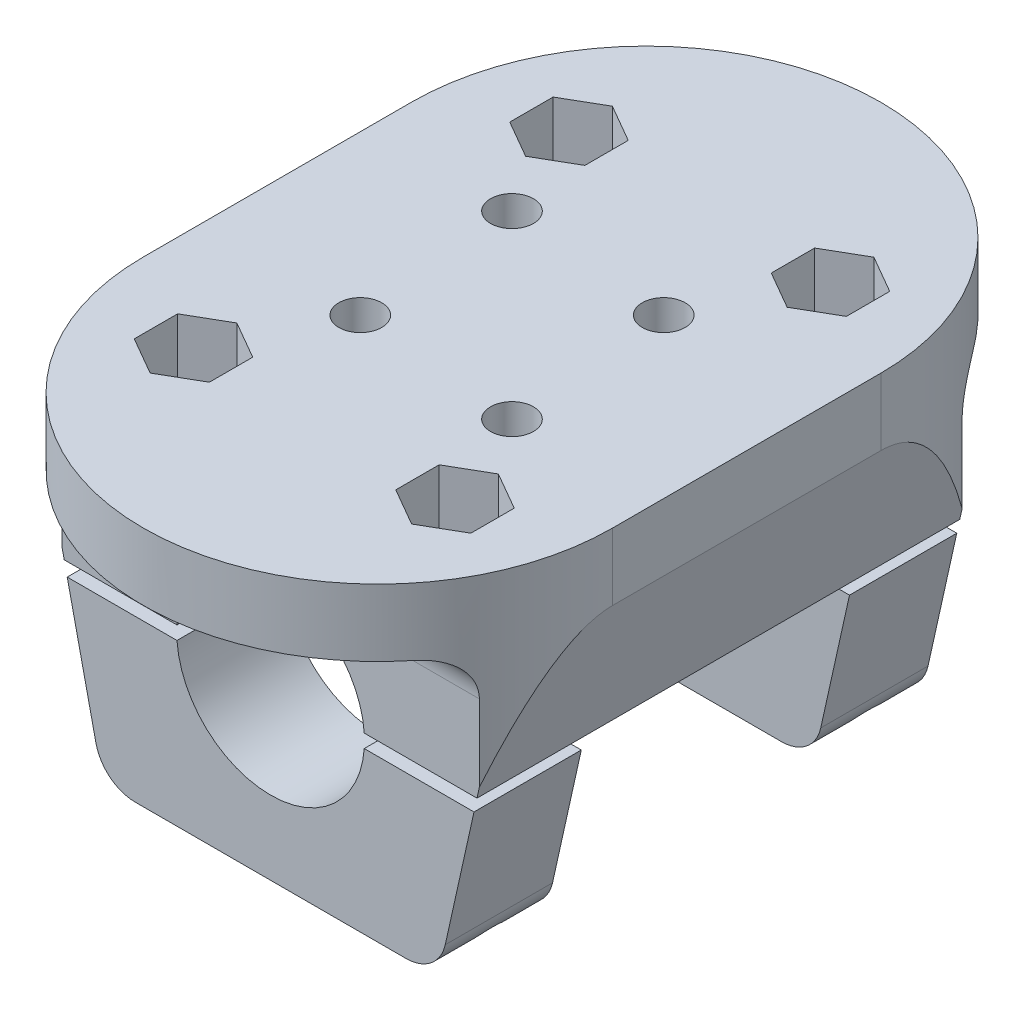
from build123d import *

# Parameters (mm, degrees)
IZIM1_R                        = 1.6
Y_KSEKLIK_EKSTR_ZYON1_DEPTH    = 5
Y_KSEKLIK_EKSTR_ZYON2_START    = -10
IZIM2_R                        = 7
Y_KSEKLIK_EKSTR_ZYON2_DEPTH    = 8
KES_EKSTR_ZYON2_DEPTH          = 43.646805273
KES_EKSTR_ZYON_NCE1_DEPTH      = 40.607448794
KES_EKSTR_ZYON_NCE1_DEPTH_BACK = 40.607448794
IZIM4_W                        = 35
IZIM4_H                        = 1
IZIM5_R                        = 1.6
KES_EKSTR_ZYON3_DEPTH          = 43.646805273
IZIM6_R                        = 2.75
KES_EKSTR_ZYON4_DEPTH          = 3.2
KES_EKSTR_ZYON5_DEPTH          = 4.5
RADYUS1_START                  = -19
RADYUS1_DEPTH                  = 10
Y_KSEKLIK_EKSTR_ZYON3_REACH    = 49.104
KES_EKSTR_ZYON6_START          = -9.5
IZIM9_R                        = 3
KES_EKSTR_ZYON6_DEPTH          = 9.5
RADYUS2_START                  = 9
RADYUS2_DEPTH                  = 10
RADYUS3_R                      = 3


with BuildPart() as part:
    # Çizim1 → Yükseklik-Ekstrüzyon1 (new body)
    with BuildSketch(Plane(origin=(0, 0, 0), x_dir=(1, 0, 0), z_dir=(0, 1, 0))):
        with BuildLine():
            Line((-17.5, -10), (-17.5, 10))
            ThreePointArc((-17.5, 10), (0, 27.5), (17.5, 10))
            Line((17.5, 10), (17.5, -10))
            ThreePointArc((17.5, -10), (0, -27.5), (-17.5, -10))
        make_face()
        with Locations(Location((5.656854249, 5.656854249, 0), (0, 0, 270))):
            Circle(IZIM1_R, mode=Mode.SUBTRACT)
        with Locations(Location((-6.717514421, 6.717514421, 0), (0, 0, 270))):
            Circle(IZIM1_R, mode=Mode.SUBTRACT)
        with Locations(Location((-5.656854249, -5.656854249, 0), (0, 0, 270))):
            Circle(IZIM1_R, mode=Mode.SUBTRACT)
        with Locations(Location((6.717514421, -6.717514421, 0), (0, 0, 270))):
            Circle(IZIM1_R, mode=Mode.SUBTRACT)
    extrude(amount=Y_KSEKLIK_EKSTR_ZYON1_DEPTH)

    # Çizim2 → Yükseklik-Ekstrüzyon2 (add)
    with BuildSketch(Plane.XY.offset(Y_KSEKLIK_EKSTR_ZYON2_START)):
        Polygon((-17.5, 0), (17.5, 0), (12.5, -22.5), (-12.5, -22.5), align=None)
        with Locations((0, -10)):
            Circle(IZIM2_R, mode=Mode.SUBTRACT)
    y_kseklik_ekstr_zyon2 = extrude(amount=-Y_KSEKLIK_EKSTR_ZYON2_DEPTH)

    # Çizim3 → Kes-Ekstrüzyon2 (cut, through all)
    with BuildSketch(Plane(origin=(0, 5, 0), x_dir=(1, 0, 0), z_dir=(0, 1, 0))):
        with BuildLine():
            Line((22.5, 10), (17.5, 10))
            ThreePointArc((17.5, 10), (0, 27.5), (-17.5, 10))
            Line((-17.5, 10), (-22.5, 10))
            Line((-22.5, 10), (-22.5, 30))
            Line((-22.5, 30), (22.5, 30))
            Line((22.5, 30), (22.5, 10))
        make_face()
    kes_ekstr_zyon2 = extrude(amount=-KES_EKSTR_ZYON2_DEPTH, mode=Mode.SUBTRACT)

    # Aynalama1: Yükseklik-Ekstrüzyon2, Kes-Ekstrüzyon2 across plane
    add(y_kseklik_ekstr_zyon2.mirror(Plane.XY))
    add(kes_ekstr_zyon2.mirror(Plane.XY), mode=Mode.SUBTRACT)

    # Çizim4 → Kes-Ekstrüzyon-İnce1 (cut, two sides: drawn at the far end of the back side and taken through both)
    with BuildSketch(Plane.XY.offset(-KES_EKSTR_ZYON_NCE1_DEPTH_BACK)):
        with Locations((0, -10)):
            Rectangle(IZIM4_W, IZIM4_H)
    extrude(amount=KES_EKSTR_ZYON_NCE1_DEPTH + KES_EKSTR_ZYON_NCE1_DEPTH_BACK, mode=Mode.SUBTRACT)


with BuildPart() as kes_ekstr_zyon_nce1_piece_1:
    # of the separate pieces the step leaves, piece 1, a body of its own (kes_ekstr_zyon_nce1_pieces)
    add(part.part.solids().sort_by_distance((-17.5, 0, 10))[0])


with BuildPart() as kes_ekstr_zyon_nce1_piece_2:
    # of the separate pieces the step leaves, piece 2, a body of its own (kes_ekstr_zyon_nce1_pieces)
    add(part.part.solids().sort_by_distance((-12.5, -22.5, 10))[0])


with BuildPart() as kes_ekstr_zyon_nce1_piece_3:
    # of the separate pieces the step leaves, piece 3, a body of its own (kes_ekstr_zyon_nce1_pieces)
    add(part.part.solids().sort_by_distance((-12.5, -22.5, -10))[0])


with BuildPart() as kes_ekstr_zyon3_tool:
    # Çizim5 → Kes-Ekstrüzyon3 (new, through all)
    with BuildSketch(Plane.XZ.offset(22.5)):
        with Locations((9.75, 14)):
            Circle(IZIM5_R)
        with Locations((-9.75, 14)):
            Circle(IZIM5_R)
        with Locations((-9.75, -14)):
            Circle(IZIM5_R)
        with Locations((9.75, -14)):
            Circle(IZIM5_R)
    extrude(amount=-KES_EKSTR_ZYON3_DEPTH)


with BuildPart() as kes_ekstr_zyon_nce1_piece_1_1:
    add(kes_ekstr_zyon_nce1_piece_1.part)

    # Kes-Ekstrüzyon3: cut by kes_ekstr_zyon3_tool
    add(kes_ekstr_zyon3_tool.part, mode=Mode.SUBTRACT)

    # Çizim7 → Kes-Ekstrüzyon5 (cut)
    with BuildSketch(Plane(origin=(0, 5, 0), x_dir=(1, 0, 0), z_dir=(0, 1, 0))):
        Polygon((-6.95, 12.383419246), (-6.95, 15.616580754), (-9.75, 17.233161507), (-12.55, 15.616580754), (-12.55, 12.383419246), (-9.75, 10.766838493), align=None)
        Polygon((6.95, 12.383419246), (6.95, 15.616580754), (9.75, 17.233161507), (12.55, 15.616580754), (12.55, 12.383419246), (9.75, 10.766838493), align=None)
        Polygon((9.75, -10.766838493), (6.95, -12.383419246), (6.95, -15.616580754), (9.75, -17.233161507), (12.55, -15.616580754), (12.55, -12.383419246), align=None)
        Polygon((-6.95, -12.383419246), (-6.95, -15.616580754), (-9.75, -17.233161507), (-12.55, -15.616580754), (-12.55, -12.383419246), (-9.75, -10.766838493), align=None)
    extrude(amount=-KES_EKSTR_ZYON5_DEPTH, mode=Mode.SUBTRACT)

    # Çizim8 → Yükseklik-Ekstrüzyon3 (add, up to next)
    with BuildSketch(Plane.XY.offset(-10), mode=Mode.PRIVATE) as y_kseklik_ekstr_zyon3_sk1:
        with BuildLine():
            Line((-17.5, 0), (-15.388888889, -9.5))
            Line((-15.388888889, -9.5), (-6.982120022, -9.5))
            ThreePointArc((-6.982120022, -9.5), (0, -3), (6.982120022, -9.5))
            Line((6.982120022, -9.5), (15.388888889, -9.5))
            Line((15.388888889, -9.5), (17.5, 0))
            Line((17.5, 0), (-17.5, 0))
        make_face()
    y_kseklik_ekstr_zyon3_tool1 = extrude(y_kseklik_ekstr_zyon3_sk1.sketch, amount=Y_KSEKLIK_EKSTR_ZYON3_REACH, mode=Mode.PRIVATE) - kes_ekstr_zyon_nce1_piece_1_1.part
    add(y_kseklik_ekstr_zyon3_tool1.solids().sort_by_distance((-16.090417, -4.671327, -10))[0])

    # Çizim9 → Kes-Ekstrüzyon6 (cut)
    with BuildSketch(Plane(origin=(0, 0, 0), x_dir=(1, 0, 0), z_dir=(0, 1, 0)).offset(KES_EKSTR_ZYON6_START)):
        with Locations(Location((6.717514421, -6.717514421, 0), (0, 0, 270))):
            Circle(IZIM9_R)
        with Locations(Location((5.656854249, 5.656854249, 0), (0, 0, 270))):
            Circle(IZIM9_R)
        with Locations(Location((-6.717514421, 6.717514421, 0), (0, 0, 270))):
            Circle(IZIM9_R)
        with Locations(Location((-5.656854249, -5.656854249, 0), (0, 0, 270))):
            Circle(IZIM9_R)
    extrude(amount=KES_EKSTR_ZYON6_DEPTH, mode=Mode.SUBTRACT)

    # Radyus3
    # the kernel refuses this fillet: 3 mm, written as the material it adds along each edge
    with BuildSketch(Plane(origin=(-23.064382416, 0, 18), x_dir=(0, -1, 0), z_dir=(1, 0, 0))) as radyus3_piece_1_section:
        with BuildLine():
            CenterArc((RADYUS3_R, -RADYUS3_R), RADYUS3_R, 90, 90)
            Line((0, -RADYUS3_R), (0, 0))
            Line((0, 0), (RADYUS3_R, 0))
        make_face()
    radyus3_piece_1 = extrude(amount=46.128764833, mode=Mode.PRIVATE)
    radyus3_piece_1 = radyus3_piece_1 & Plane(origin=(0, 0, 10), x_dir=(1, 0, 0), z_dir=(0, -1, 0)) * Cylinder(17.5, 105, mode=Mode.PRIVATE)
    add(radyus3_piece_1)
    with BuildSketch(Plane(origin=(-23.064382416, 0, -18), x_dir=(0, 0, -1), z_dir=(1, 0, 0))) as radyus3_piece_2_section:
        with BuildLine():
            CenterArc((RADYUS3_R, -RADYUS3_R), RADYUS3_R, 90, 90)
            Line((0, -RADYUS3_R), (0, 0))
            Line((0, 0), (RADYUS3_R, 0))
        make_face()
    radyus3_piece_2 = extrude(amount=46.128764833, mode=Mode.PRIVATE)
    radyus3_piece_2 = radyus3_piece_2 & Plane(origin=(0, 0, -10), x_dir=(-1, 0, 0), z_dir=(0, -1, 0)) * Cylinder(17.5, 105, mode=Mode.PRIVATE)
    add(radyus3_piece_2)


with BuildPart() as kes_ekstr_zyon_nce1_piece_2_1:
    add(kes_ekstr_zyon_nce1_piece_2.part)

    # Kes-Ekstrüzyon3: cut by kes_ekstr_zyon3_tool
    add(kes_ekstr_zyon3_tool.part, mode=Mode.SUBTRACT)


with BuildPart() as kes_ekstr_zyon_nce1_piece_3_1:
    add(kes_ekstr_zyon_nce1_piece_3.part)

    # Kes-Ekstrüzyon3: cut by kes_ekstr_zyon3_tool
    add(kes_ekstr_zyon3_tool.part, mode=Mode.SUBTRACT)


with BuildPart() as kes_ekstr_zyon4_tool:
    # Çizim6 → Kes-Ekstrüzyon4 (new body)
    with BuildSketch(Plane.XZ.offset(22.5)):
        with Locations((9.75, 14)):
            Circle(IZIM6_R)
        with Locations(Location((-9.75, 14, 0), (0, 0, 180))):
            Circle(IZIM6_R)
        with Locations((9.75, -14)):
            Circle(IZIM6_R)
        with Locations((-9.75, -14)):
            Circle(IZIM6_R)
    extrude(amount=-KES_EKSTR_ZYON4_DEPTH)


with BuildPart() as kes_ekstr_zyon_nce1_piece_2_2:
    add(kes_ekstr_zyon_nce1_piece_2_1.part)

    # Kes-Ekstrüzyon4: cut by kes_ekstr_zyon4_tool
    add(kes_ekstr_zyon4_tool.part, mode=Mode.SUBTRACT)

    # Radyus2: read off the stored shape, not the designer's step
    # Radyus2 outline → Radyus2 (cut)
    with BuildSketch(Plane.XY.offset(RADYUS2_START)):
        with BuildLine():
            Line((12.5, -22.5), (13.022046361, -20.150791373))
            ThreePointArc((13.022046361, -20.150791373), (11.970667362, -21.840125437), (10.093485181, -22.5))
            Line((10.093485181, -22.5), (12.5, -22.5))
        make_face()
        with BuildLine():
            Line((-12.5, -22.5), (-10.093485181, -22.5))
            ThreePointArc((-10.093485181, -22.5), (-11.970667362, -21.840125437), (-13.022046361, -20.150791373))
            Line((-13.022046361, -20.150791373), (-12.5, -22.5))
        make_face()
    extrude(amount=RADYUS2_DEPTH, mode=Mode.SUBTRACT)


with BuildPart() as kes_ekstr_zyon_nce1_piece_3_2:
    add(kes_ekstr_zyon_nce1_piece_3_1.part)

    # Kes-Ekstrüzyon4: cut by kes_ekstr_zyon4_tool
    add(kes_ekstr_zyon4_tool.part, mode=Mode.SUBTRACT)

    # Radyus1: read off the stored shape, not the designer's step
    # Radyus1 outline → Radyus1 (cut)
    with BuildSketch(Plane.XY.offset(RADYUS1_START)):
        with BuildLine():
            ThreePointArc((13.022046361, -20.150791373), (11.970667362, -21.840125437), (10.093485181, -22.5))
            Line((10.093485181, -22.5), (12.5, -22.5))
            Line((12.5, -22.5), (13.022046361, -20.150791373))
        make_face()
        with BuildLine():
            ThreePointArc((-10.093485181, -22.5), (-11.970667362, -21.840125437), (-13.022046361, -20.150791373))
            Line((-13.022046361, -20.150791373), (-12.5, -22.5))
            Line((-12.5, -22.5), (-10.093485181, -22.5))
        make_face()
    extrude(amount=RADYUS1_DEPTH, mode=Mode.SUBTRACT)


solid = Compound([kes_ekstr_zyon_nce1_piece_1_1.part, kes_ekstr_zyon_nce1_piece_2_2.part, kes_ekstr_zyon_nce1_piece_3_2.part])
